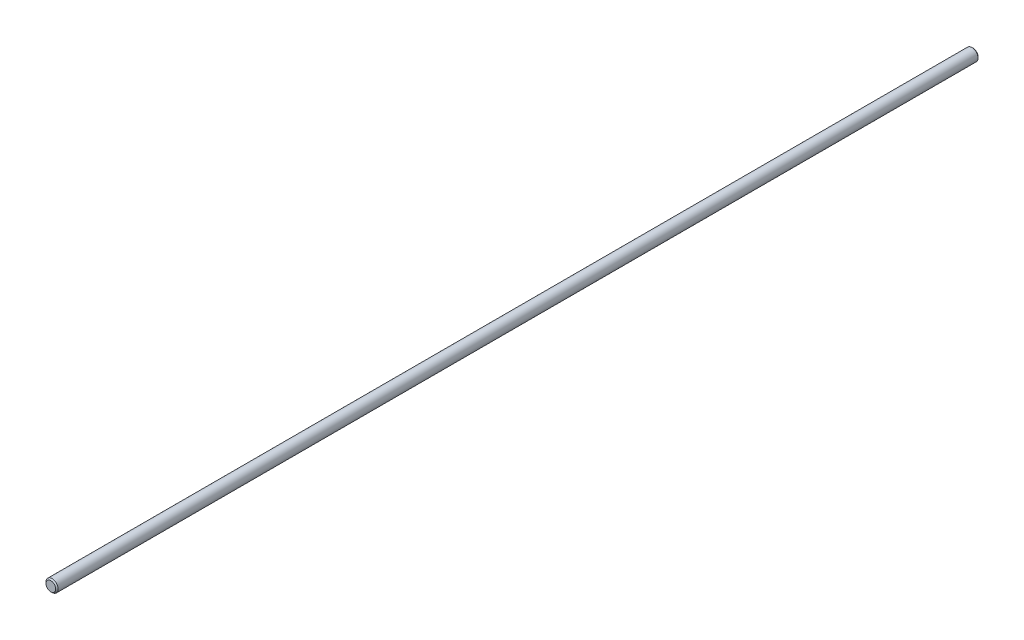
from build123d import *

# Parameters (mm, degrees)
SKETCH3_R           = 3.175
BOSS_EXTRUDE1_DEPTH = 241.3
CHAMFER1_SIZE       = 0.635


with BuildPart() as part:
    # Sketch3 → Boss-Extrude1 (new, symmetric)
    with BuildSketch(Plane.XY):
        Circle(SKETCH3_R)
    extrude(amount=BOSS_EXTRUDE1_DEPTH, both=True)

    # Chamfer1
    chamfer1_edges = [part.edges().sort_by_distance(p)[0] for p in [
        (-3.175, 0, 241.3),
        (-3.175, 0, -241.3),
    ]]
    chamfer(chamfer1_edges, length=CHAMFER1_SIZE)


solid = part.part
